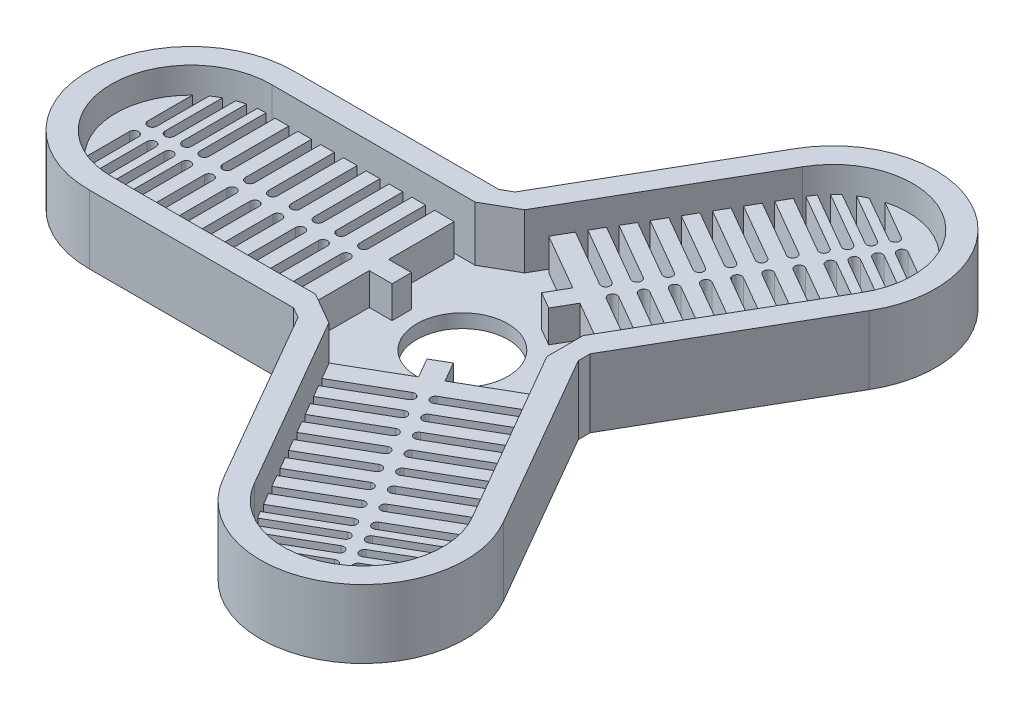
from build123d import *

# Parameters (mm, degrees)
BOSS_EXTRUDE1_DEPTH       = 10
BOSS_EXTRUDE1_2_DEPTH     = 10
BOSS_EXTRUDE1_3_DEPTH     = 10
BOSS_EXTRUDE2_DEPTH       = 15
BOSS_EXTRUDE3_OUTLINE_R   = 0.460619733
BOSS_EXTRUDE3_OUTLINE_R_2 = 10
BOSS_EXTRUDE3_DEPTH       = 3
BOSS_EXTRUDE4_DEPTH       = 15


# Read off the part's stored shape, not the designer's step: Boss-Extrude3
with BuildPart() as part:
    # Sketch1 → Boss-Extrude1 (new body)
    with BuildSketch(Plane(origin=(0, 0, 0), x_dir=(1, 0, 0), z_dir=(0, 1, 0))):
        with BuildLine():
            Line((14.43067924, -16.5), (18.707620362, -16.5))
            Line((18.707620362, -16.5), (18.707620362, -2.125))
            Line((18.707620362, -2.125), (23.707620362, -2.125))
            Line((23.707620362, -2.125), (23.707620362, 2.125))
            Line((23.707620362, 2.125), (18.707620362, 2.125))
            Line((18.707620362, 2.125), (18.707620362, 16.5))
            Line((18.707620362, 16.5), (14.43067924, 16.5))
            Line((14.43067924, 16.5), (14.43067924, 2))
            ThreePointArc((14.43067924, 2), (13.43067924, 1), (12.43067924, 2))
            Line((12.43067924, 2), (12.43067924, 16.5))
            Line((12.43067924, 16.5), (9.43067924, 16.5))
            Line((9.43067924, 16.5), (9.43067924, 2))
            ThreePointArc((9.43067924, 2), (8.43067924, 1), (7.43067924, 2))
            Line((7.43067924, 2), (7.43067924, 16.5))
            Line((7.43067924, 16.5), (4.43067924, 16.5))
            Line((4.43067924, 16.5), (4.43067924, 2))
            ThreePointArc((4.43067924, 2), (3.43067924, 1), (2.43067924, 2))
            Line((2.43067924, 2), (2.43067924, 16.5))
            Line((2.43067924, 16.5), (-0.56932076, 16.5))
            Line((-0.56932076, 16.5), (-0.56932076, 2))
            ThreePointArc((-0.56932076, 2), (-1.56932076, 1), (-2.56932076, 2))
            Line((-2.56932076, 2), (-2.56932076, 16.5))
            Line((-2.56932076, 16.5), (-5.56932076, 16.5))
            Line((-5.56932076, 16.5), (-5.56932076, 2))
            ThreePointArc((-5.56932076, 2), (-6.56932076, 1), (-7.56932076, 2))
            Line((-7.56932076, 2), (-7.56932076, 16.5))
            Line((-7.56932076, 16.5), (-10.56932076, 16.5))
            Line((-10.56932076, 16.5), (-10.56932076, 2))
            ThreePointArc((-10.56932076, 2), (-11.56932076, 1), (-12.56932076, 2))
            Line((-12.56932076, 2), (-12.56932076, 16.5))
            Line((-12.56932076, 16.5), (-15.56932076, 16.5))
            Line((-15.56932076, 16.5), (-15.56932076, 2))
            ThreePointArc((-15.56932076, 2), (-16.56932076, 1), (-17.56932076, 2))
            Line((-17.56932076, 2), (-17.56932076, 16.5))
            Line((-17.56932076, 16.5), (-20.56932076, 16.5))
            Line((-20.56932076, 16.5), (-20.56932076, 2))
            ThreePointArc((-20.56932076, 2), (-21.56932076, 1), (-22.56932076, 2))
            Line((-22.56932076, 2), (-22.56932076, 16.501001874))
            ThreePointArc((-22.56932076, 16.501001874), (-23.477396801, 16.47217544), (-24.382509891, 16.393414066))
            Line((-24.382509891, 16.393414066), (-24.382509891, 2))
            ThreePointArc((-24.382509891, 2), (-25.382509891, 1), (-26.382509891, 2))
            Line((-26.382509891, 2), (-26.382509891, 16.037892168))
            ThreePointArc((-26.382509891, 16.037892168), (-27.297019345, 15.78849181), (-28.195699021, 15.486990698))
            Line((-28.195699021, 15.486990698), (-28.195699021, 2))
            ThreePointArc((-28.195699021, 2), (-29.195699021, 1), (-30.195699021, 2))
            Line((-30.195699021, 2), (-30.195699021, 14.596714863))
            ThreePointArc((-30.195699021, 14.596714863), (-31.120205589, 14.070533886), (-32.008888152, 13.48587833))
            Line((-32.008888152, 13.48587833), (-32.008888152, 2))
            ThreePointArc((-32.008888152, 2), (-33.008888152, 1), (-34.008888152, 2))
            Line((-34.008888152, 2), (-34.008888152, 11.825115718))
            ThreePointArc((-34.008888152, 11.825115718), (-39.001147482, 0), (-34.008888152, -11.825115718))
            Line((-34.008888152, -11.825115718), (-34.008888152, -2))
            ThreePointArc((-34.008888152, -2), (-33.008888152, -1), (-32.008888152, -2))
            Line((-32.008888152, -2), (-31.946244717, -13.529831077))
            ThreePointArc((-31.946244717, -13.529831077), (-31.087905383, -14.090271444), (-30.19642277, -14.596333265))
            Line((-30.19642277, -14.596333265), (-30.195699021, -2))
            ThreePointArc((-30.195699021, -2), (-29.195699021, -1), (-28.195699021, -2))
            Line((-28.195699021, -2), (-28.133779334, -15.509622776))
            ThreePointArc((-28.133779334, -15.509622776), (-27.266183239, -15.797827875), (-26.383957388, -16.037541683))
            Line((-26.383957388, -16.037541683), (-26.382509891, -2))
            ThreePointArc((-26.382509891, -2), (-25.382509891, -1), (-24.382509891, -2))
            Line((-24.382509891, -2), (-24.382509891, -16.393414066))
            ThreePointArc((-24.382509891, -16.393414066), (-23.477396801, -16.47217544), (-22.56932076, -16.501001874))
            Line((-22.56932076, -16.501001874), (-22.56932076, -2))
            ThreePointArc((-22.56932076, -2), (-21.56932076, -1), (-20.56932076, -2))
            Line((-20.56932076, -2), (-20.56932076, -16.5))
            Line((-20.56932076, -16.5), (-17.56932076, -16.5))
            Line((-17.56932076, -16.5), (-17.56932076, -2))
            ThreePointArc((-17.56932076, -2), (-16.56932076, -1), (-15.56932076, -2))
            Line((-15.56932076, -2), (-15.56932076, -16.5))
            Line((-15.56932076, -16.5), (-12.56932076, -16.5))
            Line((-12.56932076, -16.5), (-12.56932076, -2))
            ThreePointArc((-12.56932076, -2), (-11.56932076, -1), (-10.56932076, -2))
            Line((-10.56932076, -2), (-10.56932076, -16.5))
            Line((-10.56932076, -16.5), (-7.56932076, -16.5))
            Line((-7.56932076, -16.5), (-7.56932076, -2))
            ThreePointArc((-7.56932076, -2), (-6.56932076, -1), (-5.56932076, -2))
            Line((-5.56932076, -2), (-5.56932076, -16.5))
            Line((-5.56932076, -16.5), (-2.56932076, -16.5))
            Line((-2.56932076, -16.5), (-2.56932076, -2))
            ThreePointArc((-2.56932076, -2), (-1.56932076, -1), (-0.56932076, -2))
            Line((-0.56932076, -2), (-0.56932076, -16.5))
            Line((-0.56932076, -16.5), (2.43067924, -16.5))
            Line((2.43067924, -16.5), (2.43067924, -2))
            ThreePointArc((2.43067924, -2), (3.43067924, -1), (4.43067924, -2))
            Line((4.43067924, -2), (4.43067924, -16.5))
            Line((4.43067924, -16.5), (7.43067924, -16.5))
            Line((7.43067924, -16.5), (7.43067924, -2))
            ThreePointArc((7.43067924, -2), (8.43067924, -1), (9.43067924, -2))
            Line((9.43067924, -2), (9.43067924, -16.5))
            Line((9.43067924, -16.5), (12.43067924, -16.5))
            Line((12.43067924, -16.5), (12.43067924, -2))
            ThreePointArc((12.43067924, -2), (13.43067924, -1), (14.43067924, -2))
            Line((14.43067924, -2), (14.43067924, -16.5))
        make_face()
    extrude(amount=BOSS_EXTRUDE1_DEPTH)


with BuildPart() as body_2:
    # Sketch1 → Boss-Extrude1 2 (new body)
    with BuildSketch(Plane(origin=(0, 0, 0), x_dir=(1, 0, 0), z_dir=(0, 1, 0))):
        with BuildLine():
            Line((44.305885836, -16.904165462), (31.856770656, -24.091665462))
            Line((31.856770656, -24.091665462), (33.995241218, -27.795605125))
            Line((33.995241218, -27.795605125), (46.552609573, -20.545605125))
            ThreePointArc((46.552609573, -20.545605125), (47.918634976, -20.911630528), (47.552609573, -22.277655932))
            Line((47.552609573, -22.277655932), (34.995241218, -29.527655932))
            Line((34.995241218, -29.527655932), (36.495241218, -32.125732143))
            Line((36.495241218, -32.125732143), (49.052609573, -24.875732143))
            ThreePointArc((49.052609573, -24.875732143), (50.418634976, -25.241757547), (50.052609573, -26.607782951))
            Line((50.052609573, -26.607782951), (37.495241218, -33.857782951))
            Line((37.495241218, -33.857782951), (38.995241218, -36.455859162))
            Line((38.995241218, -36.455859162), (51.552609573, -29.205859162))
            ThreePointArc((51.552609573, -29.205859162), (52.918634976, -29.571884566), (52.552609573, -30.93790997))
            Line((52.552609573, -30.93790997), (39.995241218, -38.18790997))
            Line((39.995241218, -38.18790997), (41.495241218, -40.785986181))
            Line((41.495241218, -40.785986181), (54.052609573, -33.535986181))
            ThreePointArc((54.052609573, -33.535986181), (55.418634976, -33.902011585), (55.052609573, -35.268036989))
            Line((55.052609573, -35.268036989), (42.495241218, -42.518036989))
            Line((42.495241218, -42.518036989), (43.995241218, -45.1161132))
            Line((43.995241218, -45.1161132), (56.552609573, -37.8661132))
            ThreePointArc((56.552609573, -37.8661132), (57.918634976, -38.232138604), (57.552609573, -39.598164008))
            Line((57.552609573, -39.598164008), (44.995241218, -46.848164008))
            Line((44.995241218, -46.848164008), (46.495241218, -49.446240219))
            Line((46.495241218, -49.446240219), (59.052609573, -42.196240219))
            ThreePointArc((59.052609573, -42.196240219), (60.418634976, -42.562265623), (60.052609573, -43.928291027))
            Line((60.052609573, -43.928291027), (47.495241218, -51.178291027))
            Line((47.495241218, -51.178291027), (48.995241218, -53.776367238))
            Line((48.995241218, -53.776367238), (61.552609573, -46.526367238))
            ThreePointArc((61.552609573, -46.526367238), (62.918634976, -46.892392642), (62.552609573, -48.258418046))
            Line((62.552609573, -48.258418046), (49.995241218, -55.508418046))
            Line((49.995241218, -55.508418046), (51.495241218, -58.106494257))
            Line((51.495241218, -58.106494257), (64.052609573, -50.856494257))
            ThreePointArc((64.052609573, -50.856494257), (65.418634976, -51.222519661), (65.052609573, -52.588545065))
            Line((65.052609573, -52.588545065), (52.494373569, -59.839046002))
            ThreePointArc((52.494373569, -59.839046002), (52.973376014, -60.611049704), (53.494141909, -61.355519946))
            Line((53.494141909, -61.355519946), (65.959204138, -54.158812913))
            ThreePointArc((65.959204138, -54.158812913), (67.325229542, -54.524838317), (66.959204138, -55.890863721))
            Line((66.959204138, -55.890863721), (54.802032905, -62.909809805))
            ThreePointArc((54.802032905, -62.909809805), (55.475274678, -63.577098045), (56.185722138, -64.204626919))
            Line((56.185722138, -64.204626919), (67.865798703, -57.46113157))
            ThreePointArc((67.865798703, -57.46113157), (69.231824107, -57.827156974), (68.865798703, -59.193182378))
            Line((68.865798703, -59.193182378), (57.956723627, -65.491539809))
            ThreePointArc((57.956723627, -65.491539809), (58.874663005, -66.029095494), (59.825330849, -66.506389392))
            Line((59.825330849, -66.506389392), (69.772393268, -60.763450226))
            ThreePointArc((69.772393268, -60.763450226), (71.138418672, -61.12947563), (70.772393268, -62.495501034))
            Line((70.772393268, -62.495501034), (62.263593462, -67.408058893))
            ThreePointArc((62.263593462, -67.408058893), (75.000573741, -65.818924436), (82.74529469, -55.582943175))
            Line((82.74529469, -55.582943175), (74.236494883, -60.495501034))
            ThreePointArc((74.236494883, -60.495501034), (72.87046948, -60.12947563), (73.236494883, -58.763450226))
            Line((73.236494883, -58.763450226), (83.19029978, -52.944283881))
            ThreePointArc((83.19029978, -52.944283881), (83.246485708, -51.92072003), (83.239006794, -50.89564253))
            Line((83.239006794, -50.89564253), (72.329900318, -57.193182378))
            ThreePointArc((72.329900318, -57.193182378), (70.963874914, -56.827156974), (71.329900318, -55.46113157))
            Line((71.329900318, -55.46113157), (82.998616994, -48.65269616))
            ThreePointArc((82.998616994, -48.65269616), (82.814411884, -47.757233352), (82.580897206, -46.873346448))
            Line((82.580897206, -46.873346448), (70.423305753, -53.890863721))
            ThreePointArc((70.423305753, -53.890863721), (69.057280349, -53.524838317), (69.423305753, -52.158812913))
            Line((69.423305753, -52.158812913), (81.888367981, -44.96210588))
            ThreePointArc((81.888367981, -44.96210588), (81.504020787, -44.138874265), (81.074947191, -43.338044127))
            Line((81.074947191, -43.338044127), (68.516711188, -50.588545065))
            ThreePointArc((68.516711188, -50.588545065), (67.150685784, -50.222519661), (67.516711188, -48.856494257))
            Line((67.516711188, -48.856494257), (80.074079543, -41.606494257))
            Line((80.074079543, -41.606494257), (78.574079543, -39.008418046))
            Line((78.574079543, -39.008418046), (66.016711188, -46.258418046))
            ThreePointArc((66.016711188, -46.258418046), (64.650685784, -45.892392642), (65.016711188, -44.526367238))
            Line((65.016711188, -44.526367238), (77.574079543, -37.276367238))
            Line((77.574079543, -37.276367238), (76.074079543, -34.678291027))
            Line((76.074079543, -34.678291027), (63.516711188, -41.928291027))
            ThreePointArc((63.516711188, -41.928291027), (62.150685784, -41.562265623), (62.516711188, -40.196240219))
            Line((62.516711188, -40.196240219), (75.074079543, -32.946240219))
            Line((75.074079543, -32.946240219), (73.574079543, -30.348164008))
            Line((73.574079543, -30.348164008), (61.016711188, -37.598164008))
            ThreePointArc((61.016711188, -37.598164008), (59.650685784, -37.232138604), (60.016711188, -35.8661132))
            Line((60.016711188, -35.8661132), (72.574079543, -28.6161132))
            Line((72.574079543, -28.6161132), (71.074079543, -26.018036989))
            Line((71.074079543, -26.018036989), (58.516711188, -33.268036989))
            ThreePointArc((58.516711188, -33.268036989), (57.150685784, -32.902011585), (57.516711188, -31.535986181))
            Line((57.516711188, -31.535986181), (70.074079543, -24.285986181))
            Line((70.074079543, -24.285986181), (68.574079543, -21.68790997))
            Line((68.574079543, -21.68790997), (56.016711188, -28.93790997))
            ThreePointArc((56.016711188, -28.93790997), (54.650685784, -28.571884566), (55.016711188, -27.205859162))
            Line((55.016711188, -27.205859162), (67.574079543, -19.955859162))
            Line((67.574079543, -19.955859162), (66.074079543, -17.357782951))
            Line((66.074079543, -17.357782951), (53.516711188, -24.607782951))
            ThreePointArc((53.516711188, -24.607782951), (52.150685784, -24.241757547), (52.516711188, -22.875732143))
            Line((52.516711188, -22.875732143), (65.074079543, -15.625732143))
            Line((65.074079543, -15.625732143), (63.574079543, -13.027655932))
            Line((63.574079543, -13.027655932), (51.016711188, -20.277655932))
            ThreePointArc((51.016711188, -20.277655932), (49.650685784, -19.911630528), (50.016711188, -18.545605125))
            Line((50.016711188, -18.545605125), (62.574079543, -11.295605125))
            Line((62.574079543, -11.295605125), (60.435608981, -7.591665462))
            Line((60.435608981, -7.591665462), (47.986493802, -14.779165462))
            Line((47.986493802, -14.779165462), (45.486493802, -10.449038443))
            Line((45.486493802, -10.449038443), (41.805885836, -12.574038443))
            Line((41.805885836, -12.574038443), (44.305885836, -16.904165462))
        make_face()
    extrude(amount=BOSS_EXTRUDE1_2_DEPTH)


with BuildPart() as body_3:
    # Sketch1 → Boss-Extrude1 3 (new body)
    with BuildSketch(Plane(origin=(0, 0, 0), x_dir=(1, 0, 0), z_dir=(0, 1, 0))):
        with BuildLine():
            Line((33.995241218, 27.795605125), (31.856770656, 24.091665462))
            Line((31.856770656, 24.091665462), (44.305885836, 16.904165462))
            Line((44.305885836, 16.904165462), (41.805885836, 12.574038443))
            Line((41.805885836, 12.574038443), (45.486493802, 10.449038443))
            Line((45.486493802, 10.449038443), (47.986493802, 14.779165462))
            Line((47.986493802, 14.779165462), (60.435608981, 7.591665462))
            Line((60.435608981, 7.591665462), (62.574079543, 11.295605125))
            Line((62.574079543, 11.295605125), (50.016711188, 18.545605125))
            ThreePointArc((50.016711188, 18.545605125), (49.650685784, 19.911630528), (51.016711188, 20.277655932))
            Line((51.016711188, 20.277655932), (63.574079543, 13.027655932))
            Line((63.574079543, 13.027655932), (65.074079543, 15.625732143))
            Line((65.074079543, 15.625732143), (52.516711188, 22.875732143))
            ThreePointArc((52.516711188, 22.875732143), (52.150685784, 24.241757547), (53.516711188, 24.607782951))
            Line((53.516711188, 24.607782951), (66.074079543, 17.357782951))
            Line((66.074079543, 17.357782951), (67.574079543, 19.955859162))
            Line((67.574079543, 19.955859162), (55.016711188, 27.205859162))
            ThreePointArc((55.016711188, 27.205859162), (54.650685784, 28.571884566), (56.016711188, 28.93790997))
            Line((56.016711188, 28.93790997), (68.574079543, 21.68790997))
            Line((68.574079543, 21.68790997), (70.074079543, 24.285986181))
            Line((70.074079543, 24.285986181), (57.516711188, 31.535986181))
            ThreePointArc((57.516711188, 31.535986181), (57.150685784, 32.902011585), (58.516711188, 33.268036989))
            Line((58.516711188, 33.268036989), (71.074079543, 26.018036989))
            Line((71.074079543, 26.018036989), (72.574079543, 28.6161132))
            Line((72.574079543, 28.6161132), (60.016711188, 35.8661132))
            ThreePointArc((60.016711188, 35.8661132), (59.650685784, 37.232138604), (61.016711188, 37.598164008))
            Line((61.016711188, 37.598164008), (73.574079543, 30.348164008))
            Line((73.574079543, 30.348164008), (75.074079543, 32.946240219))
            Line((75.074079543, 32.946240219), (62.516711188, 40.196240219))
            ThreePointArc((62.516711188, 40.196240219), (62.150685784, 41.562265623), (63.516711188, 41.928291027))
            Line((63.516711188, 41.928291027), (76.074079543, 34.678291027))
            Line((76.074079543, 34.678291027), (77.574079543, 37.276367238))
            Line((77.574079543, 37.276367238), (65.016711188, 44.526367238))
            ThreePointArc((65.016711188, 44.526367238), (64.650685784, 45.892392642), (66.016711188, 46.258418046))
            Line((66.016711188, 46.258418046), (78.574079543, 39.008418046))
            Line((78.574079543, 39.008418046), (80.074079543, 41.606494257))
            Line((80.074079543, 41.606494257), (67.516711188, 48.856494257))
            ThreePointArc((67.516711188, 48.856494257), (67.150685784, 50.222519661), (68.516711188, 50.588545065))
            Line((68.516711188, 50.588545065), (81.074947191, 43.338044127))
            ThreePointArc((81.074947191, 43.338044127), (81.504020787, 44.138874265), (81.888367981, 44.96210588))
            Line((81.888367981, 44.96210588), (69.423305753, 52.158812913))
            ThreePointArc((69.423305753, 52.158812913), (69.057280349, 53.524838317), (70.423305753, 53.890863721))
            Line((70.423305753, 53.890863721), (82.580476986, 46.871917637))
            ThreePointArc((82.580476986, 46.871917637), (82.821744667, 47.788606236), (83.009976884, 48.717636221))
            Line((83.009976884, 48.717636221), (71.329900318, 55.46113157))
            ThreePointArc((71.329900318, 55.46113157), (70.963874914, 56.827156974), (72.329900318, 57.193182378))
            Line((72.329900318, 57.193182378), (83.238975394, 50.894824946))
            ThreePointArc((83.238975394, 50.894824946), (83.245542584, 51.958561608), (83.183557302, 53.020511061))
            Line((83.183557302, 53.020511061), (73.236494883, 58.763450226))
            ThreePointArc((73.236494883, 58.763450226), (72.87046948, 60.12947563), (74.236494883, 60.495501034))
            Line((74.236494883, 60.495501034), (82.74529469, 55.582943175))
            ThreePointArc((82.74529469, 55.582943175), (75.000573741, 65.818924436), (62.263593462, 67.408058893))
            Line((62.263593462, 67.408058893), (70.772393268, 62.495501034))
            ThreePointArc((70.772393268, 62.495501034), (71.138418672, 61.12947563), (69.772393268, 60.763450226))
            Line((69.772393268, 60.763450226), (59.755944936, 66.474114959))
            ThreePointArc((59.755944936, 66.474114959), (58.841419675, 66.010991474), (57.957415975, 65.491975794))
            Line((57.957415975, 65.491975794), (68.865798703, 59.193182378))
            ThreePointArc((68.865798703, 59.193182378), (69.231824107, 57.827156974), (67.865798703, 57.46113157))
            Line((67.865798703, 57.46113157), (56.13516234, 64.162318936))
            ThreePointArc((56.13516234, 64.162318936), (55.451771356, 63.555061227), (54.803060182, 62.910888132))
            Line((54.803060182, 62.910888132), (66.959204138, 55.890863721))
            ThreePointArc((66.959204138, 55.890863721), (67.325229542, 54.524838317), (65.959204138, 54.158812913))
            Line((65.959204138, 54.158812913), (53.494141909, 61.355519946))
            ThreePointArc((53.494141909, 61.355519946), (52.973376014, 60.611049704), (52.494373569, 59.839046002))
            Line((52.494373569, 59.839046002), (65.052609573, 52.588545065))
            ThreePointArc((65.052609573, 52.588545065), (65.418634976, 51.222519661), (64.052609573, 50.856494257))
            Line((64.052609573, 50.856494257), (51.495241218, 58.106494257))
            Line((51.495241218, 58.106494257), (49.995241218, 55.508418046))
            Line((49.995241218, 55.508418046), (62.552609573, 48.258418046))
            ThreePointArc((62.552609573, 48.258418046), (62.918634976, 46.892392642), (61.552609573, 46.526367238))
            Line((61.552609573, 46.526367238), (48.995241218, 53.776367238))
            Line((48.995241218, 53.776367238), (47.495241218, 51.178291027))
            Line((47.495241218, 51.178291027), (60.052609573, 43.928291027))
            ThreePointArc((60.052609573, 43.928291027), (60.418634976, 42.562265623), (59.052609573, 42.196240219))
            Line((59.052609573, 42.196240219), (46.495241218, 49.446240219))
            Line((46.495241218, 49.446240219), (44.995241218, 46.848164008))
            Line((44.995241218, 46.848164008), (57.552609573, 39.598164008))
            ThreePointArc((57.552609573, 39.598164008), (57.918634976, 38.232138604), (56.552609573, 37.8661132))
            Line((56.552609573, 37.8661132), (43.995241218, 45.1161132))
            Line((43.995241218, 45.1161132), (42.495241218, 42.518036989))
            Line((42.495241218, 42.518036989), (55.052609573, 35.268036989))
            ThreePointArc((55.052609573, 35.268036989), (55.418634976, 33.902011585), (54.052609573, 33.535986181))
            Line((54.052609573, 33.535986181), (41.495241218, 40.785986181))
            Line((41.495241218, 40.785986181), (39.995241218, 38.18790997))
            Line((39.995241218, 38.18790997), (52.552609573, 30.93790997))
            ThreePointArc((52.552609573, 30.93790997), (52.918634976, 29.571884566), (51.552609573, 29.205859162))
            Line((51.552609573, 29.205859162), (38.995241218, 36.455859162))
            Line((38.995241218, 36.455859162), (37.495241218, 33.857782951))
            Line((37.495241218, 33.857782951), (50.052609573, 26.607782951))
            ThreePointArc((50.052609573, 26.607782951), (50.418634976, 25.241757547), (49.052609573, 24.875732143))
            Line((49.052609573, 24.875732143), (36.495241218, 32.125732143))
            Line((36.495241218, 32.125732143), (34.995241218, 29.527655932))
            Line((34.995241218, 29.527655932), (47.552609573, 22.277655932))
            ThreePointArc((47.552609573, 22.277655932), (47.918634976, 20.911630528), (46.552609573, 20.545605125))
            Line((46.552609573, 20.545605125), (33.995241218, 27.795605125))
        make_face()
    extrude(amount=BOSS_EXTRUDE1_3_DEPTH)


with BuildPart() as body_4:
    # Sketch1<4> → Boss-Extrude2 (new body)
    with BuildSketch(Plane(origin=(0, 0, 0), x_dir=(1, 0, 0), z_dir=(0, 1, 0))):
        with BuildLine():
            Line((22.5, -22.5), (-22.272760005, -22.5))
            ThreePointArc((-22.272760005, -22.5), (-45.001147482, 0), (-22.272760005, 22.5))
            Line((-22.272760005, 22.5), (22.5, 22.5))
            Line((22.5, 22.5), (24.764428415, 23.807368355))
            Line((24.764428415, 23.807368355), (47.150808417, 62.581715917))
            ThreePointArc((47.150808417, 62.581715917), (78.000573741, 71.015076859), (86.121951588, 40.081715917))
            Line((86.121951588, 40.081715917), (63.735571585, 1.307368355))
            ThreePointArc((63.735571585, 1.307368355), (63.338895826, 0.64669851), (62.919828601, 0))
            ThreePointArc((62.919828601, 0), (63.338895826, -0.64669851), (63.735571585, -1.307368355))
            Line((63.735571585, -1.307368355), (86.121951588, -40.081715917))
            ThreePointArc((86.121951588, -40.081715917), (78.000573741, -71.015076859), (47.150808417, -62.581715917))
            Line((47.150808417, -62.581715917), (24.764428415, -23.807368355))
            Line((24.764428415, -23.807368355), (22.5, -22.5))
        make_face()
        with BuildLine():
            Line((22.299592432, -17.5), (-22.299592432, -17.5))
            ThreePointArc((-22.299592432, -17.5), (-40.001147482, 0), (-22.299592432, 17.5))
            Line((-22.299592432, 17.5), (22.299592432, 17.5))
            Line((22.299592432, 17.5), (29.194759218, 21.4809264))
            Line((29.194759218, 21.4809264), (51.49435165, 60.10495348))
            ThreePointArc((51.49435165, 60.10495348), (75.500573741, 66.68494984), (81.805240782, 42.60495348))
            Line((81.805240782, 42.60495348), (59.50564835, 3.9809264))
            Line((59.50564835, 3.9809264), (59.50564835, -3.9809264))
            Line((59.50564835, -3.9809264), (81.805240782, -42.60495348))
            ThreePointArc((81.805240782, -42.60495348), (75.500573741, -66.68494984), (51.49435165, -60.10495348))
            Line((51.49435165, -60.10495348), (29.194759218, -21.4809264))
            Line((29.194759218, -21.4809264), (22.299592432, -17.5))
        make_face(mode=Mode.SUBTRACT)
    extrude(amount=BOSS_EXTRUDE2_DEPTH)

    # Sketch1<8> → Boss-Extrude4 (add)
    with BuildSketch(Plane(origin=(0, 0, 0), x_dir=(1, 0, 0), z_dir=(0, 1, 0))):
        with BuildLine():
            ThreePointArc((24.040085699, 22.44723003), (23.270494749, 22.486803638), (22.5, 22.5))
            Line((22.5, 22.5), (24.764428415, 23.807368355))
            ThreePointArc((24.764428415, 23.807368355), (24.390609425, 23.133502148), (24.040085699, 22.44723003))
        make_face()
        with BuildLine():
            ThreePointArc((24.040085699, -22.44723003), (24.390609425, -23.133502148), (24.764428415, -23.807368355))
            Line((24.764428415, -23.807368355), (22.5, -22.5))
            ThreePointArc((22.5, -22.5), (23.270494749, -22.486803638), (24.040085699, -22.44723003))
        make_face()
        with BuildLine():
            ThreePointArc((62.919828601, 0), (63.338895826, 0.64669851), (63.735571585, 1.307368355))
            Line((63.735571585, 1.307368355), (63.735571585, -1.307368355))
            ThreePointArc((63.735571585, -1.307368355), (63.338895826, -0.64669851), (62.919828601, 0))
        make_face()
    extrude(amount=BOSS_EXTRUDE4_DEPTH)


with BuildPart() as body_5:
    # Boss-Extrude3 outline → Boss-Extrude3 (new body)
    with BuildSketch(Plane(origin=(0, 0, 0), x_dir=(1, 0, 0), z_dir=(0, 1, 0))):
        with BuildLine():
            Line((59.50564835, 3.9809264), (81.805240782, 42.60495348))
            ThreePointArc((81.805240782, 42.60495348), (75.500573741, 66.68494984), (51.49435165, 60.10495348))
            Line((51.49435165, 60.10495348), (29.194759218, 21.4809264))
            Line((29.194759218, 21.4809264), (22.299592432, 17.5))
            Line((22.299592432, 17.5), (-22.299592432, 17.5))
            ThreePointArc((-22.299592432, 17.5), (-40.001147482, 0), (-22.299592432, -17.5))
            Line((-22.299592432, -17.5), (22.299592432, -17.5))
            Line((22.299592432, -17.5), (29.194759218, -21.4809264))
            Line((29.194759218, -21.4809264), (51.49435165, -60.10495348))
            ThreePointArc((51.49435165, -60.10495348), (75.500573741, -66.68494984), (81.805240782, -42.60495348))
            Line((81.805240782, -42.60495348), (59.50564835, -3.9809264))
            Line((59.50564835, -3.9809264), (59.50564835, 3.9809264))
        make_face()
        with Locations((-33.008888152, -2)):
            Circle(BOSS_EXTRUDE3_OUTLINE_R, mode=Mode.SUBTRACT)
        with Locations((-29.308888152, -2)):
            Circle(BOSS_EXTRUDE3_OUTLINE_R, mode=Mode.SUBTRACT)
        with Locations((-25.608888152, -2)):
            Circle(BOSS_EXTRUDE3_OUTLINE_R, mode=Mode.SUBTRACT)
        with Locations((-21.908888152, -2)):
            Circle(BOSS_EXTRUDE3_OUTLINE_R, mode=Mode.SUBTRACT)
        with Locations((-16.56932076, -2)):
            Circle(BOSS_EXTRUDE3_OUTLINE_R, mode=Mode.SUBTRACT)
        with Locations((-11.56932076, -2)):
            Circle(BOSS_EXTRUDE3_OUTLINE_R, mode=Mode.SUBTRACT)
        with Locations((-6.56932076, -2)):
            Circle(BOSS_EXTRUDE3_OUTLINE_R, mode=Mode.SUBTRACT)
        with Locations((-1.56932076, -2)):
            Circle(BOSS_EXTRUDE3_OUTLINE_R, mode=Mode.SUBTRACT)
        with Locations((3.43067924, -2)):
            Circle(BOSS_EXTRUDE3_OUTLINE_R, mode=Mode.SUBTRACT)
        with Locations((8.43067924, -2)):
            Circle(BOSS_EXTRUDE3_OUTLINE_R, mode=Mode.SUBTRACT)
        with Locations((13.43067924, -2)):
            Circle(BOSS_EXTRUDE3_OUTLINE_R, mode=Mode.SUBTRACT)
        with Locations((68.422393268, -58.425181636)):
            Circle(BOSS_EXTRUDE3_OUTLINE_R, mode=Mode.SUBTRACT)
        with Locations((64.722393268, -52.016593648)):
            Circle(BOSS_EXTRUDE3_OUTLINE_R, mode=Mode.SUBTRACT)
        with Locations((66.572393268, -55.220887642)):
            Circle(BOSS_EXTRUDE3_OUTLINE_R, mode=Mode.SUBTRACT)
        with Locations((70.272393268, -61.62947563)):
            Circle(BOSS_EXTRUDE3_OUTLINE_R, mode=Mode.SUBTRACT)
        with Locations((71.886494883, -56.425181636)):
            Circle(BOSS_EXTRUDE3_OUTLINE_R, mode=Mode.SUBTRACT)
        with Locations((73.736494883, -59.62947563)):
            Circle(BOSS_EXTRUDE3_OUTLINE_R, mode=Mode.SUBTRACT)
        with Locations((70.036494883, -53.220887642)):
            Circle(BOSS_EXTRUDE3_OUTLINE_R, mode=Mode.SUBTRACT)
        with Locations((68.186494883, -50.016593648)):
            Circle(BOSS_EXTRUDE3_OUTLINE_R, mode=Mode.SUBTRACT)
        with Locations((62.052609573, -47.392392642)):
            Circle(BOSS_EXTRUDE3_OUTLINE_R, mode=Mode.SUBTRACT)
        with Locations((65.516711188, -45.392392642)):
            Circle(BOSS_EXTRUDE3_OUTLINE_R, mode=Mode.SUBTRACT)
        with Locations((59.552609573, -43.062265623)):
            Circle(BOSS_EXTRUDE3_OUTLINE_R, mode=Mode.SUBTRACT)
        with Locations((57.052609573, -38.732138604)):
            Circle(BOSS_EXTRUDE3_OUTLINE_R, mode=Mode.SUBTRACT)
        with BuildLine():
            Line((65.959204138, -54.158812913), (53.494141909, -61.355519946))
            ThreePointArc((53.494141909, -61.355519946), (52.973376014, -60.611049704), (52.494373569, -59.839046002))
            Line((52.494373569, -59.839046002), (65.052609573, -52.588545065))
            ThreePointArc((65.052609573, -52.588545065), (65.418634976, -51.222519661), (64.052609573, -50.856494257))
            Line((64.052609573, -50.856494257), (51.495241218, -58.106494257))
            Line((51.495241218, -58.106494257), (49.995241218, -55.508418046))
            Line((49.995241218, -55.508418046), (62.552609573, -48.258418046))
            ThreePointArc((62.552609573, -48.258418046), (62.918634976, -46.892392642), (61.552609573, -46.526367238))
            Line((61.552609573, -46.526367238), (48.995241218, -53.776367238))
            Line((48.995241218, -53.776367238), (47.495241218, -51.178291027))
            Line((47.495241218, -51.178291027), (60.052609573, -43.928291027))
            ThreePointArc((60.052609573, -43.928291027), (60.418634976, -42.562265623), (59.052609573, -42.196240219))
            Line((59.052609573, -42.196240219), (46.495241218, -49.446240219))
            Line((46.495241218, -49.446240219), (44.995241218, -46.848164008))
            Line((44.995241218, -46.848164008), (57.552609573, -39.598164008))
            ThreePointArc((57.552609573, -39.598164008), (57.918634976, -38.232138604), (56.552609573, -37.8661132))
            Line((56.552609573, -37.8661132), (43.995241218, -45.1161132))
            Line((43.995241218, -45.1161132), (42.495241218, -42.518036989))
            Line((42.495241218, -42.518036989), (55.052609573, -35.268036989))
            ThreePointArc((55.052609573, -35.268036989), (55.418634976, -33.902011585), (54.052609573, -33.535986181))
            Line((54.052609573, -33.535986181), (41.495241218, -40.785986181))
            Line((41.495241218, -40.785986181), (39.995241218, -38.18790997))
            Line((39.995241218, -38.18790997), (52.552609573, -30.93790997))
            ThreePointArc((52.552609573, -30.93790997), (52.918634976, -29.571884566), (51.552609573, -29.205859162))
            Line((51.552609573, -29.205859162), (38.995241218, -36.455859162))
            Line((38.995241218, -36.455859162), (37.495241218, -33.857782951))
            Line((37.495241218, -33.857782951), (50.052609573, -26.607782951))
            ThreePointArc((50.052609573, -26.607782951), (50.418634976, -25.241757547), (49.052609573, -24.875732143))
            Line((49.052609573, -24.875732143), (36.495241218, -32.125732143))
            Line((36.495241218, -32.125732143), (34.995241218, -29.527655932))
            Line((34.995241218, -29.527655932), (47.552609573, -22.277655932))
            ThreePointArc((47.552609573, -22.277655932), (47.918634976, -20.911630529), (46.552609573, -20.545605125))
            Line((46.552609573, -20.545605125), (33.995241218, -27.795605125))
            Line((33.995241218, -27.795605125), (31.856770656, -24.091665462))
            Line((31.856770656, -24.091665462), (44.305885836, -16.904165462))
            Line((44.305885836, -16.904165462), (41.805885836, -12.574038443))
            Line((41.805885836, -12.574038443), (45.486493802, -10.449038443))
            Line((45.486493802, -10.449038443), (47.986493802, -14.779165462))
            Line((47.986493802, -14.779165462), (60.435608981, -7.591665462))
            Line((60.435608981, -7.591665462), (62.574079543, -11.295605125))
            Line((62.574079543, -11.295605125), (50.016711188, -18.545605125))
            ThreePointArc((50.016711188, -18.545605125), (49.650685784, -19.911630529), (51.016711188, -20.277655932))
            Line((51.016711188, -20.277655932), (63.574079543, -13.027655932))
            Line((63.574079543, -13.027655932), (65.074079543, -15.625732143))
            Line((65.074079543, -15.625732143), (52.516711188, -22.875732143))
            ThreePointArc((52.516711188, -22.875732143), (52.150685784, -24.241757547), (53.516711188, -24.607782951))
            Line((53.516711188, -24.607782951), (66.074079543, -17.357782951))
            Line((66.074079543, -17.357782951), (67.574079543, -19.955859162))
            Line((67.574079543, -19.955859162), (55.016711188, -27.205859162))
            ThreePointArc((55.016711188, -27.205859162), (54.650685784, -28.571884566), (56.016711188, -28.93790997))
            Line((56.016711188, -28.93790997), (68.574079543, -21.68790997))
            Line((68.574079543, -21.68790997), (70.074079543, -24.285986181))
            Line((70.074079543, -24.285986181), (57.516711188, -31.535986181))
            ThreePointArc((57.516711188, -31.535986181), (57.150685784, -32.902011585), (58.516711188, -33.268036989))
            Line((58.516711188, -33.268036989), (71.074079543, -26.018036989))
            Line((71.074079543, -26.018036989), (72.574079543, -28.6161132))
            Line((72.574079543, -28.6161132), (60.016711188, -35.8661132))
            ThreePointArc((60.016711188, -35.8661132), (59.650685784, -37.232138604), (61.016711188, -37.598164008))
            Line((61.016711188, -37.598164008), (73.574079543, -30.348164008))
            Line((73.574079543, -30.348164008), (75.074079543, -32.946240219))
            Line((75.074079543, -32.946240219), (62.516711188, -40.196240219))
            ThreePointArc((62.516711188, -40.196240219), (62.150685784, -41.562265623), (63.516711188, -41.928291027))
            Line((63.516711188, -41.928291027), (76.074079543, -34.678291027))
            Line((76.074079543, -34.678291027), (77.574079543, -37.276367238))
            Line((77.574079543, -37.276367238), (65.016711188, -44.526367238))
            ThreePointArc((65.016711188, -44.526367238), (64.650685784, -45.892392642), (66.016711188, -46.258418046))
            Line((66.016711188, -46.258418046), (78.574079543, -39.008418046))
            Line((78.574079543, -39.008418046), (80.074079543, -41.606494257))
            Line((80.074079543, -41.606494257), (67.516711188, -48.856494257))
            ThreePointArc((67.516711188, -48.856494257), (67.150685784, -50.222519661), (68.516711188, -50.588545065))
            Line((68.516711188, -50.588545065), (81.074947191, -43.338044127))
            ThreePointArc((81.074947191, -43.338044127), (81.504020787, -44.138874264), (81.888367981, -44.96210588))
            Line((81.888367981, -44.96210588), (69.423305753, -52.158812913))
            ThreePointArc((69.423305753, -52.158812913), (69.057280349, -53.524838317), (70.423305753, -53.890863721))
            Line((70.423305753, -53.890863721), (82.580897206, -46.873346448))
            ThreePointArc((82.580897206, -46.873346448), (82.814411884, -47.757233352), (82.998616994, -48.65269616))
            Line((82.998616994, -48.65269616), (71.329900318, -55.46113157))
            ThreePointArc((71.329900318, -55.46113157), (70.963874914, -56.827156974), (72.329900318, -57.193182378))
            Line((72.329900318, -57.193182378), (83.239006794, -50.89564253))
            ThreePointArc((83.239006794, -50.89564253), (83.246485708, -51.92072003), (83.19029978, -52.944283881))
            Line((83.19029978, -52.944283881), (73.236494883, -58.763450226))
            ThreePointArc((73.236494883, -58.763450226), (72.87046948, -60.12947563), (74.236494883, -60.495501034))
            Line((74.236494883, -60.495501034), (82.74529469, -55.582943175))
            ThreePointArc((82.74529469, -55.582943175), (75.000573741, -65.818924436), (62.263593462, -67.408058893))
            Line((62.263593462, -67.408058893), (70.772393268, -62.495501034))
            ThreePointArc((70.772393268, -62.495501034), (71.138418672, -61.12947563), (69.772393268, -60.763450226))
            Line((69.772393268, -60.763450226), (59.825330849, -66.506389392))
            ThreePointArc((59.825330849, -66.506389392), (58.874663005, -66.029095494), (57.956723627, -65.491539809))
            Line((57.956723627, -65.491539809), (68.865798703, -59.193182378))
            ThreePointArc((68.865798703, -59.193182378), (69.231824107, -57.827156974), (67.865798703, -57.46113157))
            Line((67.865798703, -57.46113157), (56.185722138, -64.204626919))
            ThreePointArc((56.185722138, -64.204626919), (55.475274678, -63.577098045), (54.802032905, -62.909809805))
            Line((54.802032905, -62.909809805), (66.959204138, -55.890863721))
            ThreePointArc((66.959204138, -55.890863721), (67.325229542, -54.524838317), (65.959204138, -54.158812913))
        make_face(mode=Mode.SUBTRACT)
        with Locations((60.516711188, -36.732138604)):
            Circle(BOSS_EXTRUDE3_OUTLINE_R, mode=Mode.SUBTRACT)
        with Locations((63.016711188, -41.062265623)):
            Circle(BOSS_EXTRUDE3_OUTLINE_R, mode=Mode.SUBTRACT)
        with Locations((52.052609573, -30.071884566)):
            Circle(BOSS_EXTRUDE3_OUTLINE_R, mode=Mode.SUBTRACT)
        with Locations((49.552609573, -25.741757547)):
            Circle(BOSS_EXTRUDE3_OUTLINE_R, mode=Mode.SUBTRACT)
        with Locations((53.016711188, -23.741757547)):
            Circle(BOSS_EXTRUDE3_OUTLINE_R, mode=Mode.SUBTRACT)
        with Locations((47.052609573, -21.411630528)):
            Circle(BOSS_EXTRUDE3_OUTLINE_R, mode=Mode.SUBTRACT)
        with Locations((50.516711188, -19.411630528)):
            Circle(BOSS_EXTRUDE3_OUTLINE_R, mode=Mode.SUBTRACT)
        with Locations((54.552609573, -34.402011585)):
            Circle(BOSS_EXTRUDE3_OUTLINE_R, mode=Mode.SUBTRACT)
        with Locations((58.016711188, -32.402011585)):
            Circle(BOSS_EXTRUDE3_OUTLINE_R, mode=Mode.SUBTRACT)
        with Locations((55.516711188, -28.071884566)):
            Circle(BOSS_EXTRUDE3_OUTLINE_R, mode=Mode.SUBTRACT)
        with Locations((-33.008888152, 2)):
            Circle(BOSS_EXTRUDE3_OUTLINE_R, mode=Mode.SUBTRACT)
        with Locations((-29.308888152, 2)):
            Circle(BOSS_EXTRUDE3_OUTLINE_R, mode=Mode.SUBTRACT)
        with Locations((-25.608888152, 2)):
            Circle(BOSS_EXTRUDE3_OUTLINE_R, mode=Mode.SUBTRACT)
        with Locations((-21.908888152, 2)):
            Circle(BOSS_EXTRUDE3_OUTLINE_R, mode=Mode.SUBTRACT)
        with Locations((-16.56932076, 2)):
            Circle(BOSS_EXTRUDE3_OUTLINE_R, mode=Mode.SUBTRACT)
        with Locations((-11.56932076, 2)):
            Circle(BOSS_EXTRUDE3_OUTLINE_R, mode=Mode.SUBTRACT)
        with Locations((-6.56932076, 2)):
            Circle(BOSS_EXTRUDE3_OUTLINE_R, mode=Mode.SUBTRACT)
        with Locations((-1.56932076, 2)):
            Circle(BOSS_EXTRUDE3_OUTLINE_R, mode=Mode.SUBTRACT)
        with Locations((3.43067924, 2)):
            Circle(BOSS_EXTRUDE3_OUTLINE_R, mode=Mode.SUBTRACT)
        with Locations((8.43067924, 2)):
            Circle(BOSS_EXTRUDE3_OUTLINE_R, mode=Mode.SUBTRACT)
        with Locations((13.43067924, 2)):
            Circle(BOSS_EXTRUDE3_OUTLINE_R, mode=Mode.SUBTRACT)
        with Locations((37, 0)):
            Circle(BOSS_EXTRUDE3_OUTLINE_R_2, mode=Mode.SUBTRACT)
        with Locations((47.052609573, 21.411630528)):
            Circle(BOSS_EXTRUDE3_OUTLINE_R, mode=Mode.SUBTRACT)
        with Locations((50.516711188, 19.411630528)):
            Circle(BOSS_EXTRUDE3_OUTLINE_R, mode=Mode.SUBTRACT)
        with Locations((49.552609573, 25.741757547)):
            Circle(BOSS_EXTRUDE3_OUTLINE_R, mode=Mode.SUBTRACT)
        with Locations((53.016711188, 23.741757547)):
            Circle(BOSS_EXTRUDE3_OUTLINE_R, mode=Mode.SUBTRACT)
        with Locations((52.052609573, 30.071884566)):
            Circle(BOSS_EXTRUDE3_OUTLINE_R, mode=Mode.SUBTRACT)
        with Locations((55.516711188, 28.071884566)):
            Circle(BOSS_EXTRUDE3_OUTLINE_R, mode=Mode.SUBTRACT)
        with Locations((54.552609573, 34.402011585)):
            Circle(BOSS_EXTRUDE3_OUTLINE_R, mode=Mode.SUBTRACT)
        with Locations((58.016711188, 32.402011585)):
            Circle(BOSS_EXTRUDE3_OUTLINE_R, mode=Mode.SUBTRACT)
        with Locations((57.052609573, 38.732138604)):
            Circle(BOSS_EXTRUDE3_OUTLINE_R, mode=Mode.SUBTRACT)
        with BuildLine():
            Line((69.423305753, 52.158812913), (81.888367981, 44.96210588))
            ThreePointArc((81.888367981, 44.96210588), (81.504020787, 44.138874264), (81.074947191, 43.338044127))
            Line((81.074947191, 43.338044127), (68.516711188, 50.588545065))
            ThreePointArc((68.516711188, 50.588545065), (67.150685784, 50.222519661), (67.516711188, 48.856494257))
            Line((67.516711188, 48.856494257), (80.074079543, 41.606494257))
            Line((80.074079543, 41.606494257), (78.574079543, 39.008418046))
            Line((78.574079543, 39.008418046), (66.016711188, 46.258418046))
            ThreePointArc((66.016711188, 46.258418046), (64.650685784, 45.892392642), (65.016711188, 44.526367238))
            Line((65.016711188, 44.526367238), (77.574079543, 37.276367238))
            Line((77.574079543, 37.276367238), (76.074079543, 34.678291027))
            Line((76.074079543, 34.678291027), (63.516711188, 41.928291027))
            ThreePointArc((63.516711188, 41.928291027), (62.150685784, 41.562265623), (62.516711188, 40.196240219))
            Line((62.516711188, 40.196240219), (75.074079543, 32.946240219))
            Line((75.074079543, 32.946240219), (73.574079543, 30.348164008))
            Line((73.574079543, 30.348164008), (61.016711188, 37.598164008))
            ThreePointArc((61.016711188, 37.598164008), (59.650685784, 37.232138604), (60.016711188, 35.8661132))
            Line((60.016711188, 35.8661132), (72.574079543, 28.6161132))
            Line((72.574079543, 28.6161132), (71.074079543, 26.018036989))
            Line((71.074079543, 26.018036989), (58.516711188, 33.268036989))
            ThreePointArc((58.516711188, 33.268036989), (57.150685784, 32.902011585), (57.516711188, 31.535986181))
            Line((57.516711188, 31.535986181), (70.074079543, 24.285986181))
            Line((70.074079543, 24.285986181), (68.574079543, 21.68790997))
            Line((68.574079543, 21.68790997), (56.016711188, 28.93790997))
            ThreePointArc((56.016711188, 28.93790997), (54.650685784, 28.571884566), (55.016711188, 27.205859162))
            Line((55.016711188, 27.205859162), (67.574079543, 19.955859162))
            Line((67.574079543, 19.955859162), (66.074079543, 17.357782951))
            Line((66.074079543, 17.357782951), (53.516711188, 24.607782951))
            ThreePointArc((53.516711188, 24.607782951), (52.150685784, 24.241757547), (52.516711188, 22.875732143))
            Line((52.516711188, 22.875732143), (65.074079543, 15.625732143))
            Line((65.074079543, 15.625732143), (63.574079543, 13.027655932))
            Line((63.574079543, 13.027655932), (51.016711188, 20.277655932))
            ThreePointArc((51.016711188, 20.277655932), (49.650685784, 19.911630529), (50.016711188, 18.545605125))
            Line((50.016711188, 18.545605125), (62.574079543, 11.295605125))
            Line((62.574079543, 11.295605125), (60.435608981, 7.591665462))
            Line((60.435608981, 7.591665462), (47.986493802, 14.779165462))
            Line((47.986493802, 14.779165462), (45.486493802, 10.449038443))
            Line((45.486493802, 10.449038443), (41.805885836, 12.574038443))
            Line((41.805885836, 12.574038443), (44.305885836, 16.904165462))
            Line((44.305885836, 16.904165462), (31.856770656, 24.091665462))
            Line((31.856770656, 24.091665462), (33.995241218, 27.795605125))
            Line((33.995241218, 27.795605125), (46.552609573, 20.545605125))
            ThreePointArc((46.552609573, 20.545605125), (47.918634976, 20.911630529), (47.552609573, 22.277655932))
            Line((47.552609573, 22.277655932), (34.995241218, 29.527655932))
            Line((34.995241218, 29.527655932), (36.495241218, 32.125732143))
            Line((36.495241218, 32.125732143), (49.052609573, 24.875732143))
            ThreePointArc((49.052609573, 24.875732143), (50.418634976, 25.241757547), (50.052609573, 26.607782951))
            Line((50.052609573, 26.607782951), (37.495241218, 33.857782951))
            Line((37.495241218, 33.857782951), (38.995241218, 36.455859162))
            Line((38.995241218, 36.455859162), (51.552609573, 29.205859162))
            ThreePointArc((51.552609573, 29.205859162), (52.918634976, 29.571884566), (52.552609573, 30.93790997))
            Line((52.552609573, 30.93790997), (39.995241218, 38.18790997))
            Line((39.995241218, 38.18790997), (41.495241218, 40.785986181))
            Line((41.495241218, 40.785986181), (54.052609573, 33.535986181))
            ThreePointArc((54.052609573, 33.535986181), (55.418634976, 33.902011585), (55.052609573, 35.268036989))
            Line((55.052609573, 35.268036989), (42.495241218, 42.518036989))
            Line((42.495241218, 42.518036989), (43.995241218, 45.1161132))
            Line((43.995241218, 45.1161132), (56.552609573, 37.8661132))
            ThreePointArc((56.552609573, 37.8661132), (57.918634976, 38.232138604), (57.552609573, 39.598164008))
            Line((57.552609573, 39.598164008), (44.995241218, 46.848164008))
            Line((44.995241218, 46.848164008), (46.495241218, 49.446240219))
            Line((46.495241218, 49.446240219), (59.052609573, 42.196240219))
            ThreePointArc((59.052609573, 42.196240219), (60.418634976, 42.562265623), (60.052609573, 43.928291027))
            Line((60.052609573, 43.928291027), (47.495241218, 51.178291027))
            Line((47.495241218, 51.178291027), (48.995241218, 53.776367238))
            Line((48.995241218, 53.776367238), (61.552609573, 46.526367238))
            ThreePointArc((61.552609573, 46.526367238), (62.918634976, 46.892392642), (62.552609573, 48.258418046))
            Line((62.552609573, 48.258418046), (49.995241218, 55.508418046))
            Line((49.995241218, 55.508418046), (51.495241218, 58.106494257))
            Line((51.495241218, 58.106494257), (64.052609573, 50.856494257))
            ThreePointArc((64.052609573, 50.856494257), (65.418634976, 51.222519661), (65.052609573, 52.588545065))
            Line((65.052609573, 52.588545065), (52.494373569, 59.839046002))
            ThreePointArc((52.494373569, 59.839046002), (52.973376014, 60.611049704), (53.494141909, 61.355519946))
            Line((53.494141909, 61.355519946), (65.959204138, 54.158812913))
            ThreePointArc((65.959204138, 54.158812913), (67.325229542, 54.524838317), (66.959204138, 55.890863721))
            Line((66.959204138, 55.890863721), (54.803060182, 62.910888132))
            ThreePointArc((54.803060182, 62.910888132), (55.451771356, 63.555061227), (56.13516234, 64.162318936))
            Line((56.13516234, 64.162318936), (67.865798703, 57.46113157))
            ThreePointArc((67.865798703, 57.46113157), (69.231824107, 57.827156974), (68.865798703, 59.193182378))
            Line((68.865798703, 59.193182378), (57.957415975, 65.491975794))
            ThreePointArc((57.957415975, 65.491975794), (58.841419675, 66.010991474), (59.755944936, 66.474114959))
            Line((59.755944936, 66.474114959), (69.772393268, 60.763450226))
            ThreePointArc((69.772393268, 60.763450226), (71.138418672, 61.12947563), (70.772393268, 62.495501034))
            Line((70.772393268, 62.495501034), (62.263593462, 67.408058893))
            ThreePointArc((62.263593462, 67.408058893), (75.000573741, 65.818924436), (82.74529469, 55.582943175))
            Line((82.74529469, 55.582943175), (74.236494883, 60.495501034))
            ThreePointArc((74.236494883, 60.495501034), (72.87046948, 60.12947563), (73.236494883, 58.763450226))
            Line((73.236494883, 58.763450226), (83.183557302, 53.020511061))
            ThreePointArc((83.183557302, 53.020511061), (83.245542584, 51.958561608), (83.238975394, 50.894824946))
            Line((83.238975394, 50.894824946), (72.329900318, 57.193182378))
            ThreePointArc((72.329900318, 57.193182378), (70.963874914, 56.827156974), (71.329900318, 55.46113157))
            Line((71.329900318, 55.46113157), (83.009976884, 48.717636221))
            ThreePointArc((83.009976884, 48.717636221), (82.821744667, 47.788606236), (82.580476986, 46.871917637))
            Line((82.580476986, 46.871917637), (70.423305753, 53.890863721))
            ThreePointArc((70.423305753, 53.890863721), (69.057280349, 53.524838317), (69.423305753, 52.158812913))
        make_face(mode=Mode.SUBTRACT)
        with Locations((60.516711188, 36.732138604)):
            Circle(BOSS_EXTRUDE3_OUTLINE_R, mode=Mode.SUBTRACT)
        with Locations((59.552609573, 43.062265623)):
            Circle(BOSS_EXTRUDE3_OUTLINE_R, mode=Mode.SUBTRACT)
        with Locations((63.016711188, 41.062265623)):
            Circle(BOSS_EXTRUDE3_OUTLINE_R, mode=Mode.SUBTRACT)
        with Locations((62.052609573, 47.392392642)):
            Circle(BOSS_EXTRUDE3_OUTLINE_R, mode=Mode.SUBTRACT)
        with Locations((65.516711188, 45.392392642)):
            Circle(BOSS_EXTRUDE3_OUTLINE_R, mode=Mode.SUBTRACT)
        with Locations((68.186494883, 50.016593648)):
            Circle(BOSS_EXTRUDE3_OUTLINE_R, mode=Mode.SUBTRACT)
        with Locations((64.722393268, 52.016593648)):
            Circle(BOSS_EXTRUDE3_OUTLINE_R, mode=Mode.SUBTRACT)
        with Locations((66.572393268, 55.220887642)):
            Circle(BOSS_EXTRUDE3_OUTLINE_R, mode=Mode.SUBTRACT)
        with Locations((68.422393268, 58.425181636)):
            Circle(BOSS_EXTRUDE3_OUTLINE_R, mode=Mode.SUBTRACT)
        with Locations((70.036494883, 53.220887642)):
            Circle(BOSS_EXTRUDE3_OUTLINE_R, mode=Mode.SUBTRACT)
        with Locations((71.886494883, 56.425181636)):
            Circle(BOSS_EXTRUDE3_OUTLINE_R, mode=Mode.SUBTRACT)
        with Locations((73.736494883, 59.62947563)):
            Circle(BOSS_EXTRUDE3_OUTLINE_R, mode=Mode.SUBTRACT)
        with Locations((70.272393268, 61.62947563)):
            Circle(BOSS_EXTRUDE3_OUTLINE_R, mode=Mode.SUBTRACT)
    extrude(amount=BOSS_EXTRUDE3_DEPTH)


solid = Compound([part.part, body_2.part, body_3.part, body_4.part, body_5.part])
